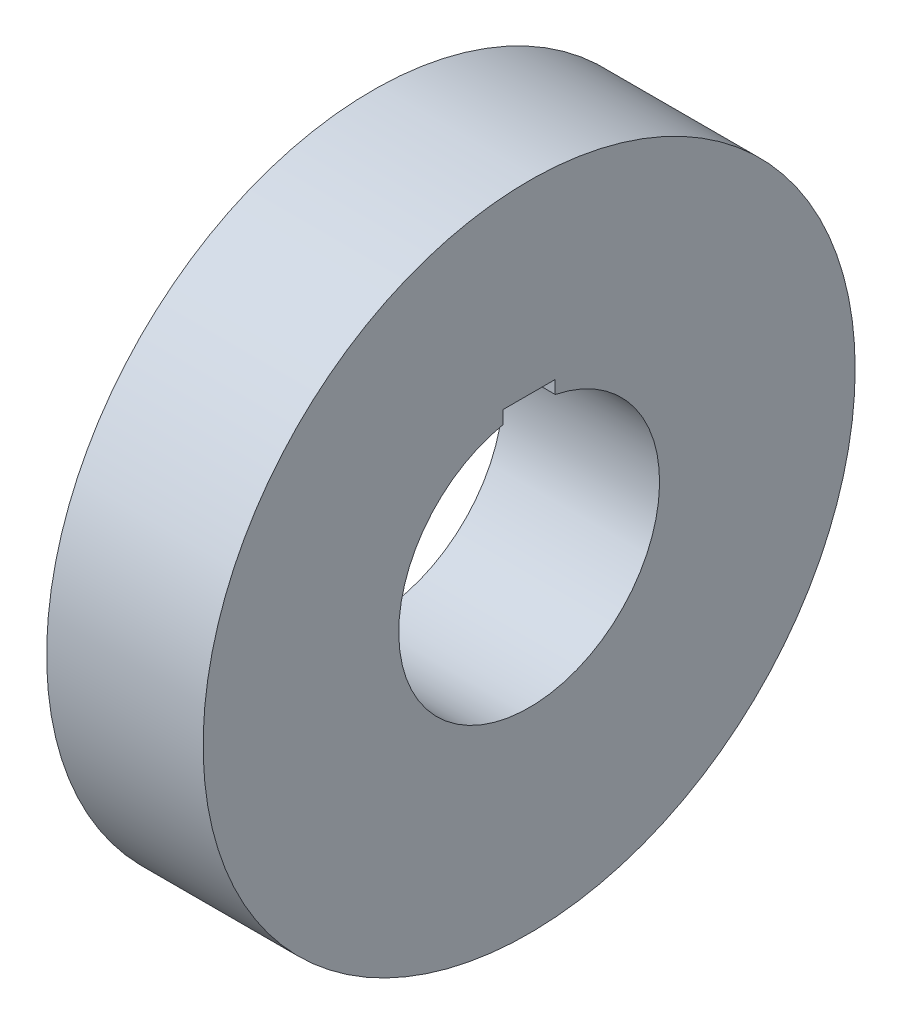
from build123d import *

# Parameters (mm, degrees)
SKETCH1_R           = 25
SKETCH1_R_2         = 10
BOSS_EXTRUDE1_DEPTH = 12
CUT_EXTRUDE1_DEPTH  = 38.336309405


with BuildPart() as part:
    # Sketch1 → Boss-Extrude1 (new body)
    with BuildSketch(Plane(origin=(0, 0, 0), x_dir=(0, 0, -1), z_dir=(1, 0, 0))):
        Circle(SKETCH1_R)
        Circle(SKETCH1_R_2, mode=Mode.SUBTRACT)
    extrude(amount=BOSS_EXTRUDE1_DEPTH)

    # Sketch2 → Cut-Extrude1 (cut, through all)
    with BuildSketch(Plane(origin=(12, 0, 0), x_dir=(0, 0, -1), z_dir=(1, 0, 0))):
        with BuildLine():
            ThreePointArc((-2, 9.797958971), (0, 10), (2, 9.797958971))
            Line((2, 9.797958971), (2, 10.797958971))
            Line((2, 10.797958971), (-2, 10.797958971))
            Line((-2, 10.797958971), (-2, 9.797958971))
        make_face()
    extrude(amount=-CUT_EXTRUDE1_DEPTH, mode=Mode.SUBTRACT)


solid = part.part
